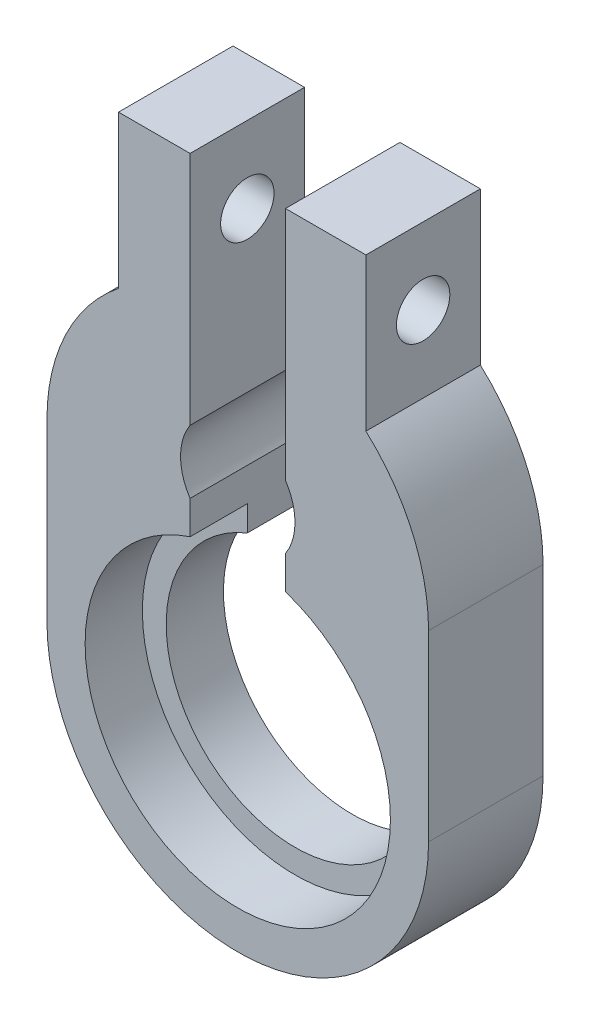
from build123d import *

# Parameters (mm, degrees)
BOSS_EXTRUDE1_DEPTH = 6
SKETCH2_R           = 1.4
CUT_EXTRUDE1_DEPTH  = 30
SKETCH3_R           = 8
CUT_EXTRUDE2_DEPTH  = 3
FILLET1_R           = 10
FILLET2_R           = 10


with BuildPart() as part:
    # Sketch1 → Boss-Extrude1 (new body)
    with BuildSketch(Plane(origin=(0, 0, 0), x_dir=(0, 1, 0), z_dir=(0, 0, 1))):
        with BuildLine():
            Line((6.269968102, 2.5), (9.341687605, 2.5))
            ThreePointArc((9.341687605, 2.5), (11, 3), (12.658312395, 2.5))
            Line((12.658312395, 2.5), (25, 2.5))
            Line((25, 2.5), (25, 6.25))
            Line((25, 6.25), (17, 6.25))
            Line((17, 6.25), (17, 10))
            Line((17, 10), (0, 10))
            ThreePointArc((0, 10), (-10, 0), (0, -10))
            Line((0, -10), (17, -10))
            Line((17, -10), (17, -6.715626424))
            Line((17, -6.715626424), (25, -6.715626424))
            Line((25, -6.715626424), (25, -2.5))
            Line((25, -2.5), (12.658312395, -2.5))
            ThreePointArc((12.658312395, -2.5), (11, -3), (9.341687605, -2.5))
            Line((9.341687605, -2.5), (6.269968102, -2.5))
            ThreePointArc((6.269968102, -2.5), (-6.75, 0), (6.269968102, 2.5))
        make_face()
    extrude(amount=BOSS_EXTRUDE1_DEPTH)

    # Sketch2 → Cut-Extrude1 (cut)
    with BuildSketch(Plane.YZ.offset(10)):
        with Locations(Location((21, 3, 0), (0, 0, 270))):
            Circle(SKETCH2_R)
    extrude(amount=-CUT_EXTRUDE1_DEPTH, mode=Mode.SUBTRACT)

    # Sketch3 → Cut-Extrude2 (cut)
    with BuildSketch(Plane.XY.offset(6)):
        Circle(SKETCH3_R)
    extrude(amount=-CUT_EXTRUDE2_DEPTH, mode=Mode.SUBTRACT)

    # Fillet1
    # the kernel refuses this fillet: 10 mm, written as the material it takes off along each edge
    with BuildSketch(Plane(origin=(10, 17, -18.523694578), x_dir=(-1, 0, 0), z_dir=(0, 0, 1))) as fillet1_piece_1:
        with BuildLine():
            CenterArc((10, 7.409477831), FILLET1_R, 180, 47.812214848)
            Line((0, 7.409477831), (-0.2, 7.409477831))
            Line((-0.2, 7.409477831), (-0.2, 0))
            Line((-0.2, 0), (0, -0.2))
            ThreePointArc((0, -0.2), (1.642186788, -0.2), (3.150061047, -0.148189557))
            Line((3.150061047, -0.148189557), (3.284373576, 0))
        make_face()
    extrude(amount=43.047389155, mode=Mode.SUBTRACT)

    # Fillet2
    # the kernel refuses this fillet: 10 mm, written as the material it takes off along each edge
    with BuildSketch(Plane(origin=(-10, 17, -19.515618745), x_dir=(0, -1, 0), z_dir=(0, 0, 1))) as fillet2_piece_1:
        with BuildLine():
            CenterArc((7.806247498, 10), FILLET2_R, 218.682187453, 51.317812547)
            Line((0, 3.75), (-0.15612495, 3.625))
            ThreePointArc((-0.15612495, 3.625), (-0.2, 1.875), (-0.2, 0))
            Line((-0.2, 0), (0, -0.2))
            Line((0, -0.2), (7.806247498, -0.2))
            Line((7.806247498, -0.2), (7.806247498, 0))
        make_face()
    extrude(amount=45.03123749, mode=Mode.SUBTRACT)


solid = part.part
